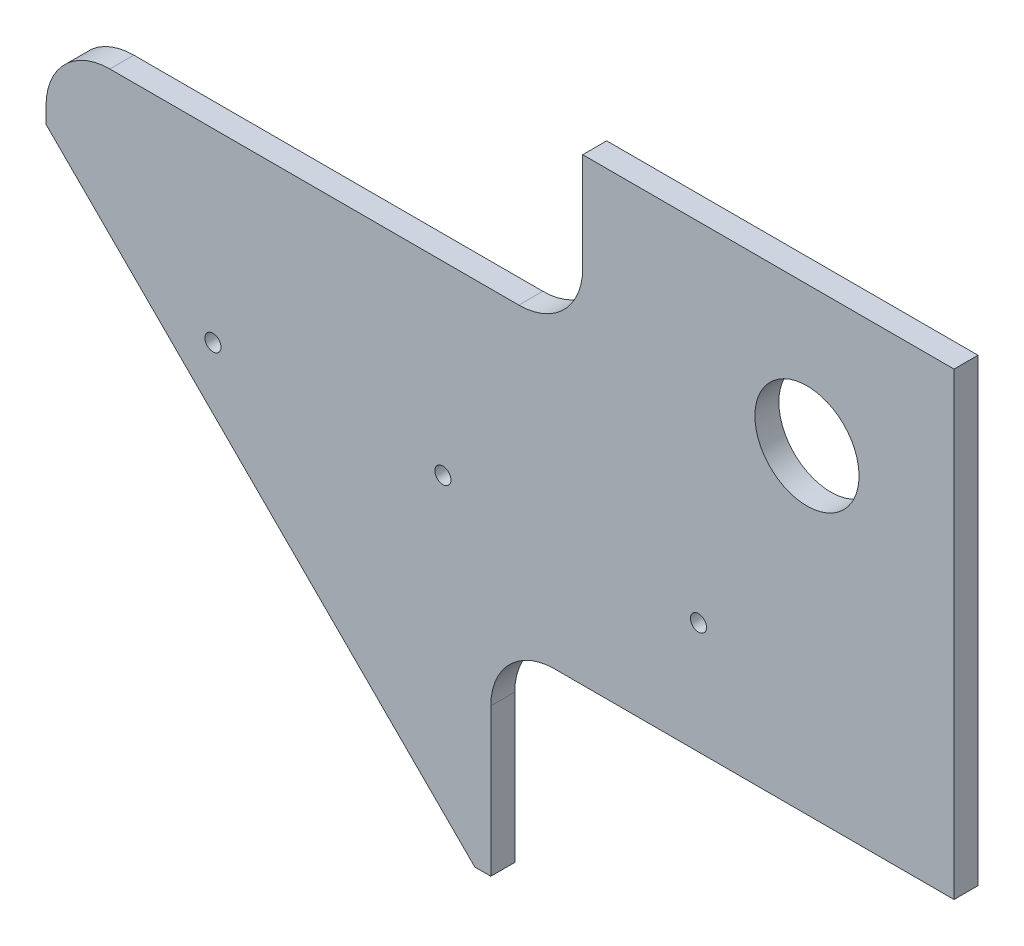
from build123d import *

# Parameters (mm, degrees)
SKETCH1_R                  = 20.701
BOSS_EXTRUDE1_DEPTH        = 9.525
SKETCH2_W                  = 184.15
SKETCH2_H                  = 84.074
CUT_EXTRUDE1_DEPTH         = 267.58430025
FILLET1_R                  = 25.4
SKETCH4_W                  = 213.36
SKETCH4_H                  = 65.465352004
CUT_EXTRUDE2_DEPTH         = 267.58430025
FILLET2_R                  = 25.4
F_6_4_6_4_DIAMETER_HOLE2_D = 6.4
SKETCH16_W                 = 9.525
SKETCH16_H                 = 0.985363282
CUT_EXTRUDE3_DEPTH         = 390.572219806


with BuildPart() as part:
    # Sketch1 → Boss-Extrude1 (new body)
    with BuildSketch(Plane.XY):
        Polygon((-138.259383474, 48.991487021), (32.210627804, -121.478524257), (222.710627804, -121.478524257), (222.710627804, 146.206839025), (-138.259383474, 146.206839025), align=None)
        with Locations((164.245911629, 89.531975743)):
            Circle(SKETCH1_R, mode=Mode.SUBTRACT)
    extrude(amount=BOSS_EXTRUDE1_DEPTH)

    # Sketch2 → Cut-Extrude1 (cut, through all)
    with BuildSketch(Plane.XY.offset(9.525)):
        with Locations((130.635627804, -79.441524257)):
            Rectangle(SKETCH2_W, SKETCH2_H)
    extrude(amount=-CUT_EXTRUDE1_DEPTH, mode=Mode.SUBTRACT)

    # Fillet1
    fillet1_edges = [part.edges().sort_by_distance(p)[0] for p in [
        (38.560627804, -37.404524257, 4.7625),
    ]]
    fillet(fillet1_edges, radius=FILLET1_R)

    # Sketch4 → Cut-Extrude2 (cut, through all)
    with BuildSketch(Plane.XY.offset(9.525)):
        with Locations((-31.579383474, 113.474163023)):
            Rectangle(SKETCH4_W, SKETCH4_H)
    extrude(amount=-CUT_EXTRUDE2_DEPTH, mode=Mode.SUBTRACT)

    # Fillet2
    fillet2_edges = [part.edges().sort_by_distance(p)[0] for p in [
        (-138.259383474, 80.741487021, 4.7625),
        (75.100616526, 80.741487021, 4.7625),
    ]]
    fillet(fillet2_edges, radius=FILLET2_R)

    # Ø6.4 (6.4) Diameter Hole2 (through all)
    with Locations(Plane(origin=(0, 0, 0), x_dir=(-1, 0, 0), z_dir=(0, 0, -1))):
        with Locations((-121.110627804, 7.042935743), (-19.510627804, 7.042935743), (71.895728372, 7.042935743)):
            Hole(F_6_4_6_4_DIAMETER_HOLE2_D / 2)

    # Sketch16 → Cut-Extrude3 (cut, through all)
    with BuildSketch(Plane(origin=(222.710627804, 0, 0), x_dir=(0, 0, -1), z_dir=(1, 0, 0))):
        with Locations((-4.7625, 145.714157384)):
            Rectangle(SKETCH16_W, SKETCH16_H)
    extrude(amount=-CUT_EXTRUDE3_DEPTH, mode=Mode.SUBTRACT)


solid = part.part
